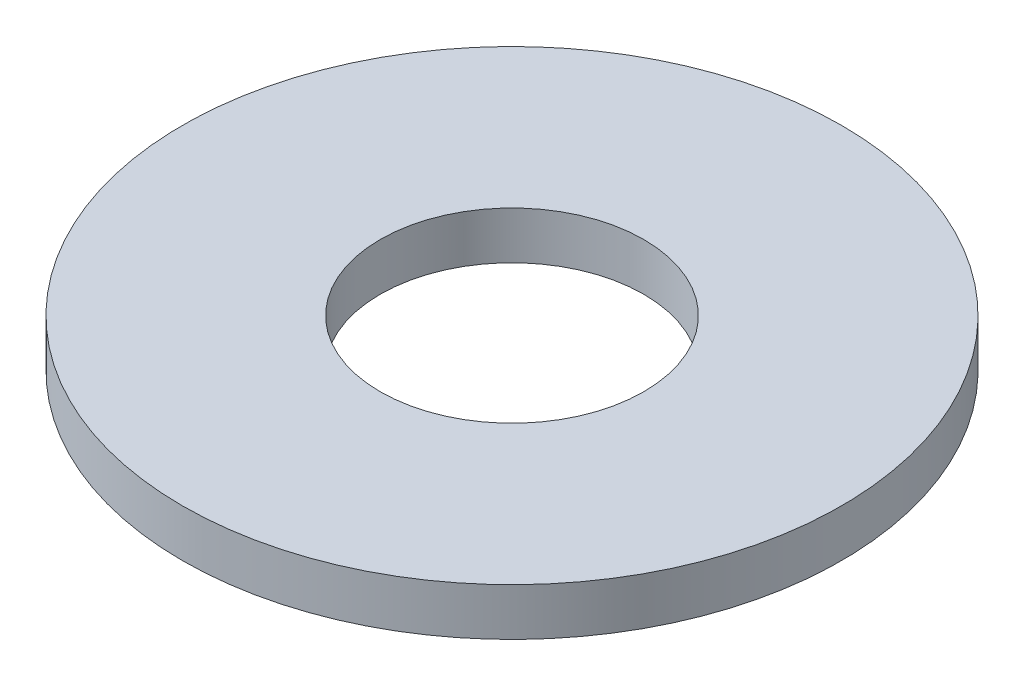
from build123d import *

# Parameters (mm, degrees)
SKETCH1_R           = 62.5
BOSS_EXTRUDE1_DEPTH = 9
SKETCH2_R           = 25
CUT_EXTRUDE1_DEPTH  = 89.845371292


with BuildPart() as part:
    # Sketch1 → Boss-Extrude1 (new body)
    with BuildSketch(Plane(origin=(0, 0, 0), x_dir=(1, 0, 0), z_dir=(0, 1, 0))):
        Circle(SKETCH1_R)
    extrude(amount=BOSS_EXTRUDE1_DEPTH)

    # Sketch2 → Cut-Extrude1 (cut, through all)
    with BuildSketch(Plane(origin=(0, 0, 0), x_dir=(1, 0, 0), z_dir=(0, 1, 0))):
        Circle(SKETCH2_R)
    extrude(amount=CUT_EXTRUDE1_DEPTH, mode=Mode.SUBTRACT)


solid = part.part
